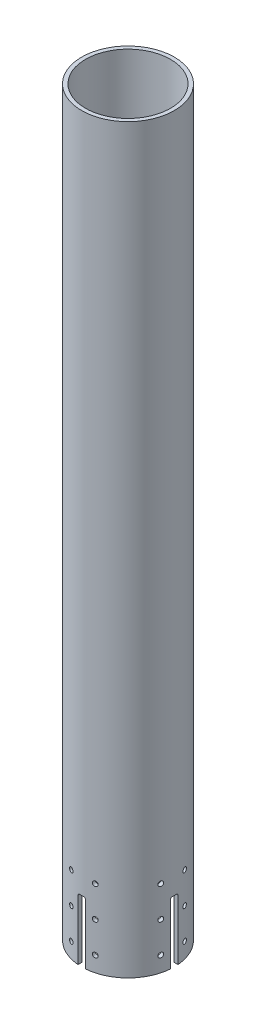
from build123d import *

# Parameters (mm, degrees)
SKETCH1_W                   = 1.5875
SKETCH1_H                   = 304.8
SKETCH3_W                   = 3.175
SKETCH3_H                   = 25.4
CUT_EXTRUDE2_DEPTH          = 50.8
FILLET1_R                   = 0.79375
CIRPATTERN1_COUNT           = 4
FILLET1_OF_CIRPATTERN1_R    = 0.79375
SKETCH6_R                   = 1
CUT_EXTRUDE13_DEPTH         = 12.7
CIRPATTERN3_COUNT           = 4
CIRPATTERN3_COPY_1_SKETCH_R = 1
CIRPATTERN3_COPY_1_DEPTH    = 12.7
CIRPATTERN3_COPY_2_SKETCH_R = 1
CIRPATTERN3_COPY_2_DEPTH    = 12.7
CIRPATTERN3_COPY_3_SKETCH_R = 1
CIRPATTERN3_COPY_3_DEPTH    = 12.7


with BuildPart() as part:
    # Sketch1 → Revolve2 (revolve)
    with BuildSketch(Plane.XY):
        with Locations((-18.25625, 152.4)):
            Rectangle(SKETCH1_W, SKETCH1_H)
    revolve(axis=Axis((0, 0, 0), (0, 1, 0)))

    # Sketch3 → Cut-Extrude2 (cut)
    with BuildSketch(Plane.XY):
        with Locations((0, 12.7)):
            Rectangle(SKETCH3_W, SKETCH3_H)
    cut_extrude2 = extrude(amount=-CUT_EXTRUDE2_DEPTH, mode=Mode.SUBTRACT)

    # Fillet1
    fillet1_edges = [part.edges().sort_by_distance(p)[0] for p in [
        (-1.5875, 25.4, -18.186965065),
        (1.5875, 25.4, -18.186965065),
    ]]
    fillet(fillet1_edges, radius=FILLET1_R)

    # CirPattern1: Cut-Extrude2 ×4 about axis
    cirpattern1_axis = Axis((0, 0, 0), (0, -1, 0))
    for i in range(1, CIRPATTERN1_COUNT):
        add(cut_extrude2.rotate(cirpattern1_axis, i * 360 / CIRPATTERN1_COUNT), mode=Mode.SUBTRACT)

    # Fillet1 of CirPattern1
    fillet1_of_cirpattern1_edges = [part.edges().sort_by_distance(p)[0] for p in [
        (18.186965065, 25.4, -1.5875),
        (18.186965065, 25.4, 1.5875),
        (1.5875, 25.4, 18.186965065),
        (-1.5875, 25.4, 18.186965065),
        (-18.186965065, 25.4, 1.5875),
        (-18.186965065, 25.4, -1.5875),
    ]]
    fillet(fillet1_of_cirpattern1_edges, radius=FILLET1_OF_CIRPATTERN1_R)

    # Sketch6 → Cut-Extrude13 (cut, symmetric)
    with BuildSketch(Plane(origin=(4.721504469, 0, -16.813386991), x_dir=(0.9659258262890682, 0, 0.25881904510252135), z_dir=(-0.2588190451025213, 0, 0.9659258262890681))):
        with Locations((-0.20899834, 6.35)):
            Circle(SKETCH6_R)
        with Locations((-0.20899834, 19.05)):
            Circle(SKETCH6_R)
        with Locations((-0.20899834, 31.75)):
            Circle(SKETCH6_R)
    cut_extrude13 = extrude(amount=CUT_EXTRUDE13_DEPTH, both=True, mode=Mode.SUBTRACT)

    # Mirror1: Cut-Extrude13 across plane
    add(cut_extrude13.mirror(Plane(origin=(0, 0, 0), x_dir=(0, 0, 1), z_dir=(1, 0, 0))), mode=Mode.SUBTRACT)

    # CirPattern3: Cut-Extrude13 ×4 about axis
    cirpattern3_axis = Axis((0, 0, 0), (0, -1, 0))
    for i in range(1, CIRPATTERN3_COUNT):
        add(cut_extrude13.rotate(cirpattern3_axis, i * 360 / CIRPATTERN3_COUNT), mode=Mode.SUBTRACT)

    # CirPattern3 copy 1 sketch → CirPattern3 copy 1 (cut, symmetric)
    with BuildSketch(Plane(origin=(16.813386991, 0, -4.721504469), x_dir=(-0.2588190451025214, 0, -0.9659258262890682), z_dir=(-0.9659258262890681, 0, 0.25881904510252135))):
        with Locations((-0.20899834, -6.35)):
            Circle(CIRPATTERN3_COPY_1_SKETCH_R)
        with Locations((-0.20899834, -19.05)):
            Circle(CIRPATTERN3_COPY_1_SKETCH_R)
        with Locations((-0.20899834, -31.75)):
            Circle(CIRPATTERN3_COPY_1_SKETCH_R)
    extrude(amount=CIRPATTERN3_COPY_1_DEPTH, both=True, mode=Mode.SUBTRACT)

    # CirPattern3 copy 2 sketch → CirPattern3 copy 2 (cut, symmetric)
    with BuildSketch(Plane(origin=(4.721504469, 0, 16.813386991), x_dir=(0.9659258262890682, 0, -0.25881904510252146), z_dir=(-0.2588190451025214, 0, -0.9659258262890681))):
        with Locations((-0.20899834, -6.35)):
            Circle(CIRPATTERN3_COPY_2_SKETCH_R)
        with Locations((-0.20899834, -19.05)):
            Circle(CIRPATTERN3_COPY_2_SKETCH_R)
        with Locations((-0.20899834, -31.75)):
            Circle(CIRPATTERN3_COPY_2_SKETCH_R)
    extrude(amount=CIRPATTERN3_COPY_2_DEPTH, both=True, mode=Mode.SUBTRACT)

    # CirPattern3 copy 3 sketch → CirPattern3 copy 3 (cut, symmetric)
    with BuildSketch(Plane(origin=(-16.813386991, 0, 4.721504469), x_dir=(0.2588190451025215, 0, 0.9659258262890682), z_dir=(0.9659258262890681, 0, -0.25881904510252146))):
        with Locations((-0.20899834, -6.35)):
            Circle(CIRPATTERN3_COPY_3_SKETCH_R)
        with Locations((-0.20899834, -19.05)):
            Circle(CIRPATTERN3_COPY_3_SKETCH_R)
        with Locations((-0.20899834, -31.75)):
            Circle(CIRPATTERN3_COPY_3_SKETCH_R)
    extrude(amount=CIRPATTERN3_COPY_3_DEPTH, both=True, mode=Mode.SUBTRACT)


solid = part.part
